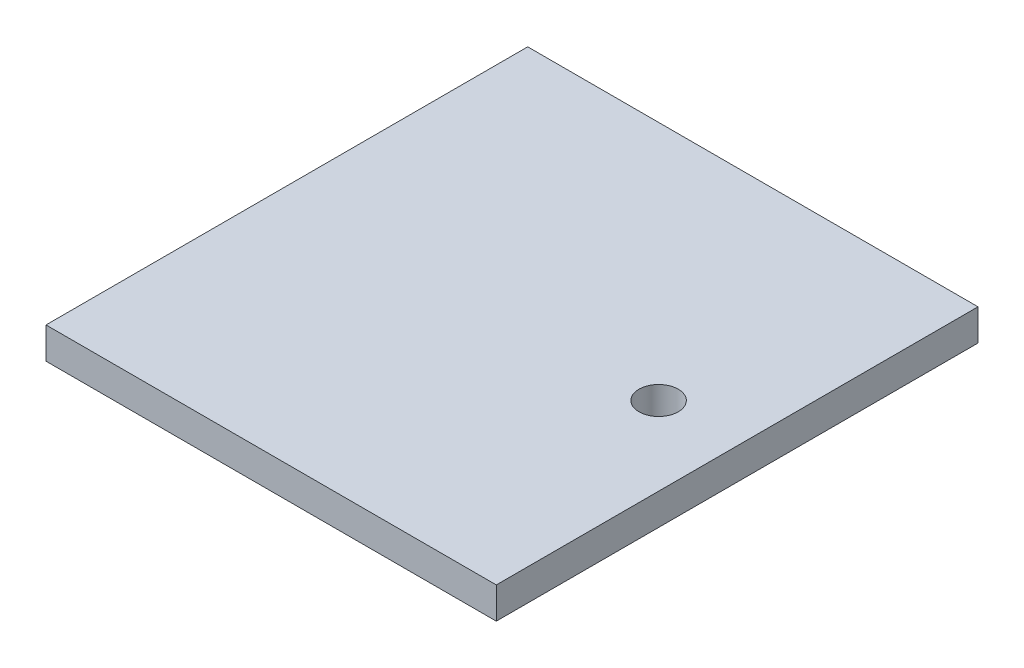
from build123d import *

# Parameters (mm, degrees)
SKETCH1_W                  = 86
SKETCH1_H                  = 92
BOSS_EXTRUDE1_DEPTH        = 6
F_7_5_7_5_DIAMETER_HOLE1_D = 7.5


with BuildPart() as part:
    # Sketch1 → Boss-Extrude1 (new body)
    with BuildSketch(Plane(origin=(0, 0, 0), x_dir=(1, 0, 0), z_dir=(0, 1, 0))):
        with Locations((43, 46)):
            Rectangle(SKETCH1_W, SKETCH1_H)
    extrude(amount=BOSS_EXTRUDE1_DEPTH)

    # Ø7.5 (7.5) Diameter Hole1 (through all)
    with Locations(Plane(origin=(0, 6, 0), x_dir=(1, 0, 0), z_dir=(0, 1, 0))):
        with Locations((71, 46)):
            Hole(F_7_5_7_5_DIAMETER_HOLE1_D / 2)


solid = part.part
